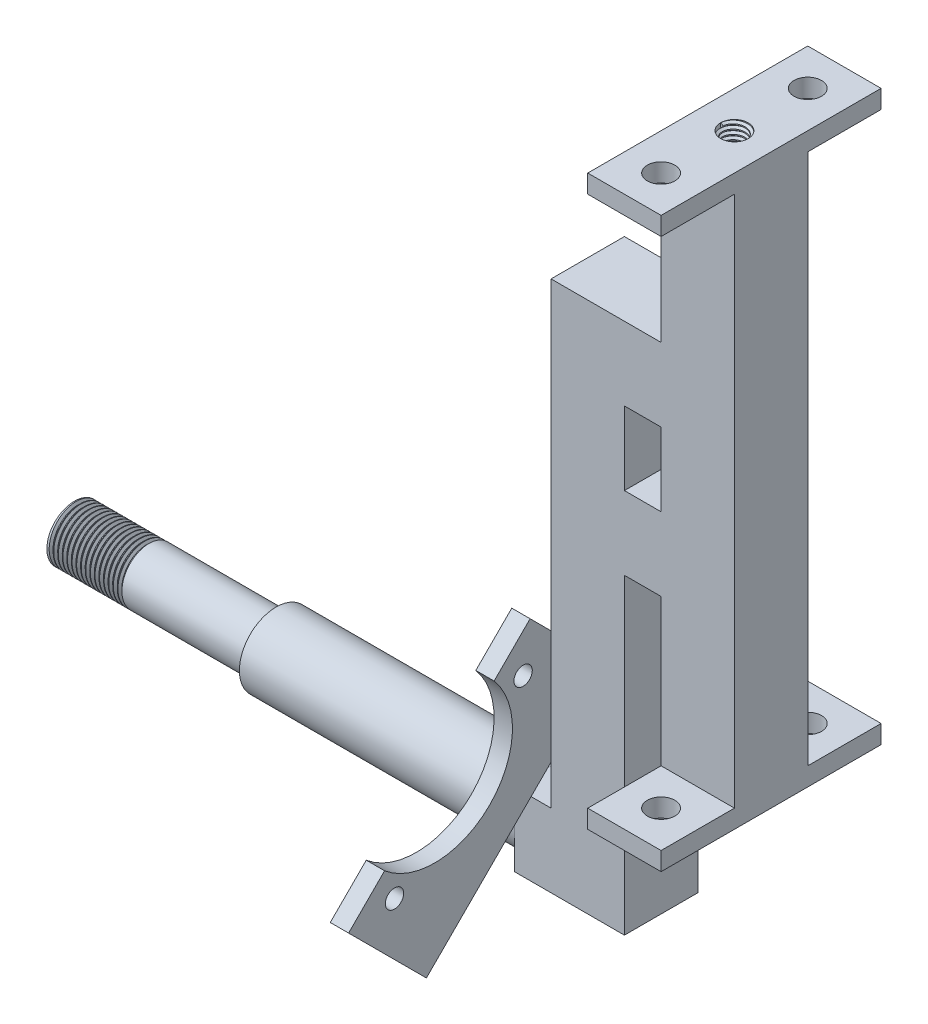
from build123d import *
from build123d.topology import SkipClean

# Parameters (mm, degrees)
SKETCH1_W               = 25.4
SKETCH1_H               = 25.4
SKETCH1_W_2             = 20.32
SKETCH1_H_2             = 20.32
SQ_TB_EXTRUDE_DEPTH     = 196.85
SKETCH3_W               = 20.32
SKETCH3_H               = 20.32
SKETCH3_R               = 4.7625
SKETCH3_W_2             = 25.4
SKETCH3_H_2             = 25.4
END_CAPS_DEPTH          = 6.35
TOP_THREAD_PITCH        = 1.5875
BOTTOM_THREAD_PITCH     = 1.5875
SQ_TB_ANGLES_DEPTH      = 12.7
SQ_TB_ANGLES_DEPTH_BACK = 12.7
WHEEL_THREADS_PITCH     = 1.5875
SKETCH12_R              = 3.175
BOSS_EXTRUDE1_DEPTH     = 6.35


with BuildPart() as part:
    # Sketch1 → Sq_Tb Extrude (new body)
    with BuildSketch(Plane(origin=(0, 0, 0), x_dir=(1, 0, 0), z_dir=(0, 1, 0))):
        Rectangle(SKETCH1_W, SKETCH1_H)
        Rectangle(SKETCH1_W_2, SKETCH1_H_2, mode=Mode.SUBTRACT)
    extrude(amount=SQ_TB_EXTRUDE_DEPTH)

    # Sketch3 → End Caps (add)
    # profile 1 of 3: a face of its own
    with BuildSketch(Plane(origin=(0, 196.85, 0), x_dir=(1, 0, 0), z_dir=(0, 1, 0))):
        Rectangle(SKETCH3_W, SKETCH3_H)
        with Locations(Location((0, 0, 0), (0, 0, 270))):
            Circle(SKETCH3_R, mode=Mode.SUBTRACT)
    # profile 2 of 3: a face of its own
    with BuildSketch(Plane(origin=(0, 196.85, 0), x_dir=(1, 0, 0), z_dir=(0, 1, 0))):
        with Locations((0, 25.4)):
            Rectangle(SKETCH3_W_2, SKETCH3_H_2)
        with Locations(Location((0, 25.4, 0), (0, 0, 270))):
            Circle(SKETCH3_R, mode=Mode.SUBTRACT)
    # profile 3 of 3: a face of its own
    with BuildSketch(Plane(origin=(0, 196.85, 0), x_dir=(1, 0, 0), z_dir=(0, 1, 0))):
        with Locations((0, -25.4)):
            Rectangle(SKETCH3_W_2, SKETCH3_H_2)
        with Locations(Location((0, -25.4, 0), (0, 0, 90))):
            Circle(SKETCH3_R, mode=Mode.SUBTRACT)
    end_caps = extrude(amount=-END_CAPS_DEPTH)

    # End Cap Mirror: End Caps across plane
    add(end_caps.mirror(Plane.ZX.offset(98.425)))

    # Top Thread: the profile of Thread Profile1 profile screwed along a right-hand helix of 4 turns, 8 arcs to a turn; built about Z, then put on its axis
    with SkipClean():  # the faces are left unmerged after this step: merging them gives an invalid solid
        top_thread_z = Axis((0, 0, 0), (0, 0, 1))
        top_thread_corners = [(4.7628, 0, -0.000173205), (4.7628, 0, 1.389235701), (3.903240423, 0, 0.892968748), (3.903240423, 0, 0.496093748)]
        with BuildLine(mode=Mode.PRIVATE) as top_thread_profile:
            Line(top_thread_corners[0], top_thread_corners[1])
            Line(top_thread_corners[1], top_thread_corners[2])
            Line(top_thread_corners[2], top_thread_corners[3])
            Line(top_thread_corners[3], top_thread_corners[0])
        top_thread_cap = Face(top_thread_profile.wire())
        top_thread_turn_angles = [0, 22.5, 45, 67.5, 90, 112.5, 135, 157.5, 180, 202.5, 225, 247.5, 270, 292.5, 315, 337.5, 360]
        top_thread_turn_weights = [1, 0.9238795325112867, 1, 0.9238795325112867, 1, 0.9238795325112867, 1, 0.9238795325112867, 1, 0.9238795325112867, 1, 0.9238795325112867, 1, 0.9238795325112867, 1, 0.9238795325112867, 1]
        top_thread_turn_rails = [Edge.make_bspline([Vector(p[0], p[1], 0).rotate(top_thread_z, top_thread_turn_angles[k]) / top_thread_turn_weights[k] + Vector(0, 0, p[2] + TOP_THREAD_PITCH * top_thread_turn_angles[k] / 360) for k in range(17)], [0, 0, 0, 1, 1, 2, 2, 3, 3, 4, 4, 5, 5, 6, 6, 7, 7, 8, 8, 8], 2, top_thread_turn_weights) for p in top_thread_corners]
        top_thread_turn_sides = [Face.make_surface_from_curves(top_thread_turn_rails[p[0]], top_thread_turn_rails[p[1]]) for p in [(0, 1), (1, 2), (2, 3), (3, 0)]]
        top_thread = Plane(origin=(0, 196.85, 0), x_dir=(-1, 0, 0), z_dir=(0, -1, 0)) * Solid(Shell([*[p.moved(Location((0, 0, TOP_THREAD_PITCH * i))) for i in range(4) for p in top_thread_turn_sides], top_thread_cap, top_thread_cap.rotate(top_thread_z, 1440).moved(Location((0, 0, TOP_THREAD_PITCH * 1440 / 360)))]))
        add(top_thread)

    # Bottom Thread: the profile of Thread Profile2 profile screwed along a right-hand helix of 4 turns, 8 arcs to a turn; built about Z, then put on its axis
    with SkipClean():  # the faces are left unmerged after this step: merging them gives an invalid solid
        bottom_thread_z = Axis((0, 0, 0), (0, 0, 1))
        bottom_thread_corners = [(4.7628, 0, -0.000173205), (4.7628, 0, 1.389235701), (3.903240423, 0, 0.892968748), (3.903240423, 0, 0.496093748)]
        with BuildLine(mode=Mode.PRIVATE) as bottom_thread_profile:
            Line(bottom_thread_corners[0], bottom_thread_corners[1])
            Line(bottom_thread_corners[1], bottom_thread_corners[2])
            Line(bottom_thread_corners[2], bottom_thread_corners[3])
            Line(bottom_thread_corners[3], bottom_thread_corners[0])
        bottom_thread_cap = Face(bottom_thread_profile.wire())
        bottom_thread_turn_angles = [0, 22.5, 45, 67.5, 90, 112.5, 135, 157.5, 180, 202.5, 225, 247.5, 270, 292.5, 315, 337.5, 360]
        bottom_thread_turn_weights = [1, 0.9238795325112867, 1, 0.9238795325112867, 1, 0.9238795325112867, 1, 0.9238795325112867, 1, 0.9238795325112867, 1, 0.9238795325112867, 1, 0.9238795325112867, 1, 0.9238795325112867, 1]
        bottom_thread_turn_rails = [Edge.make_bspline([Vector(p[0], p[1], 0).rotate(bottom_thread_z, bottom_thread_turn_angles[k]) / bottom_thread_turn_weights[k] + Vector(0, 0, p[2] + BOTTOM_THREAD_PITCH * bottom_thread_turn_angles[k] / 360) for k in range(17)], [0, 0, 0, 1, 1, 2, 2, 3, 3, 4, 4, 5, 5, 6, 6, 7, 7, 8, 8, 8], 2, bottom_thread_turn_weights) for p in bottom_thread_corners]
        bottom_thread_turn_sides = [Face.make_surface_from_curves(bottom_thread_turn_rails[p[0]], bottom_thread_turn_rails[p[1]]) for p in [(0, 1), (1, 2), (2, 3), (3, 0)]]
        bottom_thread = Plane(origin=(0, 0, 0), x_dir=(1, 0, 0), z_dir=(0, 1, 0)) * Solid(Shell([*[p.moved(Location((0, 0, BOTTOM_THREAD_PITCH * i))) for i in range(4) for p in bottom_thread_turn_sides], bottom_thread_cap, bottom_thread_cap.rotate(bottom_thread_z, 1440).moved(Location((0, 0, BOTTOM_THREAD_PITCH * 1440 / 360)))]))
        add(bottom_thread)

    # Sketch9 → Sq_Tb Angles (add, two sides: drawn at the far end of the back side and taken through both)
    with SkipClean():  # the faces are left unmerged after this step: merging them gives an invalid solid
        with BuildSketch(Plane.XY.offset(-SQ_TB_ANGLES_DEPTH_BACK)):
            Polygon((-63.5, -50.8), (-25.4, -50.8), (-25.4, -25.4), (-25.4, 57.15), (-12.7, 57.15), (-12.7, 82.55), (-25.4, 82.55), (-25.4, 107.95), (-12.7, 107.95), (-12.7, 133.35), (-50.8, 133.35), (-50.8, 107.95), (-50.8, -25.4), (-63.1414809, -25.4), (-63.5, -25.4), align=None)
        extrude(amount=SQ_TB_ANGLES_DEPTH + SQ_TB_ANGLES_DEPTH_BACK)

    # Sketch11 → Wheel Rod (revolve)
    with SkipClean():  # the faces are left unmerged after this step: merging them gives an invalid solid
        with BuildSketch(Plane.XY):
            Polygon((-63.5, -38.1), (-228.6, -38.1), (-228.6, -28.575), (-158.75, -28.575), (-158.75, -25.4), (-63.5, -25.4), align=None)
        revolve(axis=Axis((-63.5, -38.1, 0), (-1, 0, 0)))

    # Wheel Threads: the profile of Thread Profile3 profile screwed along a right-hand helix of 16 turns, 8 arcs to a turn; built about Z, then put on its axis
    with SkipClean():  # the faces are left unmerged after this step: merging them gives an invalid solid
        wheel_threads_z = Axis((0, 0, 0), (0, 0, 1))
        wheel_threads_corners = [(9.5253, 0, -0.000173205), (9.5253, 0, 1.389235701), (8.665740423, 0, 0.892968748), (8.665740423, 0, 0.496093748)]
        with BuildLine(mode=Mode.PRIVATE) as wheel_threads_profile:
            Line(wheel_threads_corners[0], wheel_threads_corners[1])
            Line(wheel_threads_corners[1], wheel_threads_corners[2])
            Line(wheel_threads_corners[2], wheel_threads_corners[3])
            Line(wheel_threads_corners[3], wheel_threads_corners[0])
        wheel_threads_cap = Face(wheel_threads_profile.wire())
        wheel_threads_turn_angles = [0, 22.5, 45, 67.5, 90, 112.5, 135, 157.5, 180, 202.5, 225, 247.5, 270, 292.5, 315, 337.5, 360]
        wheel_threads_turn_weights = [1, 0.9238795325112867, 1, 0.9238795325112867, 1, 0.9238795325112867, 1, 0.9238795325112867, 1, 0.9238795325112867, 1, 0.9238795325112867, 1, 0.9238795325112867, 1, 0.9238795325112867, 1]
        wheel_threads_turn_rails = [Edge.make_bspline([Vector(p[0], p[1], 0).rotate(wheel_threads_z, wheel_threads_turn_angles[k]) / wheel_threads_turn_weights[k] + Vector(0, 0, p[2] + WHEEL_THREADS_PITCH * wheel_threads_turn_angles[k] / 360) for k in range(17)], [0, 0, 0, 1, 1, 2, 2, 3, 3, 4, 4, 5, 5, 6, 6, 7, 7, 8, 8, 8], 2, wheel_threads_turn_weights) for p in wheel_threads_corners]
        wheel_threads_turn_sides = [Face.make_surface_from_curves(wheel_threads_turn_rails[p[0]], wheel_threads_turn_rails[p[1]]) for p in [(0, 1), (1, 2), (2, 3), (3, 0)]]
        wheel_threads = Plane(origin=(-228.6, -38.1, 0), x_dir=(0, 0, -1), z_dir=(1, 0, 0)) * Solid(Shell([*[p.moved(Location((0, 0, WHEEL_THREADS_PITCH * i))) for i in range(16) for p in wheel_threads_turn_sides], wheel_threads_cap, wheel_threads_cap.rotate(wheel_threads_z, 5760).moved(Location((0, 0, WHEEL_THREADS_PITCH * 5760 / 360)))]))
        add(wheel_threads, mode=Mode.SUBTRACT)

    # Sketch12 → Boss-Extrude1 (add)
    # profile 1 of 2: a face of its own
    with SkipClean():  # the faces are left unmerged after this step: merging them gives an invalid solid
        with BuildSketch(Plane.ZY.offset(50.8)):
            with BuildLine():
                Line((82.827132063, -27.80971043), (70.367659342, -15.350237709))
                ThreePointArc((70.367659342, -15.350237709), (33.958290046, -13.8167596), (32.424811936, 22.592609696))
                Line((32.424811936, 22.592609696), (19.965339215, 35.052082417))
                Line((19.965339215, 35.052082417), (12.7, 27.786743202))
                Line((12.7, 27.786743202), (12.7, -11.564115094))
                Line((12.7, -11.564115094), (55.8863637, -54.750478794))
                Line((55.8863637, -54.750478794), (82.827132063, -27.80971043))
            make_face()
            with Locations((66.934907156, -25.387869705)):
                Circle(SKETCH12_R, mode=Mode.SUBTRACT)
            with Locations((22.387179941, 19.15985751)):
                Circle(SKETCH12_R, mode=Mode.SUBTRACT)
        # profile 2 of 2: a face of its own
        with BuildSketch(Plane.ZY.offset(50.8)):
            Polygon((-6.975429148, 8.111314054), (12.7, -11.564115094), (12.7, 27.786743202), align=None)
        extrude(amount=BOSS_EXTRUDE1_DEPTH)


solid = part.part
